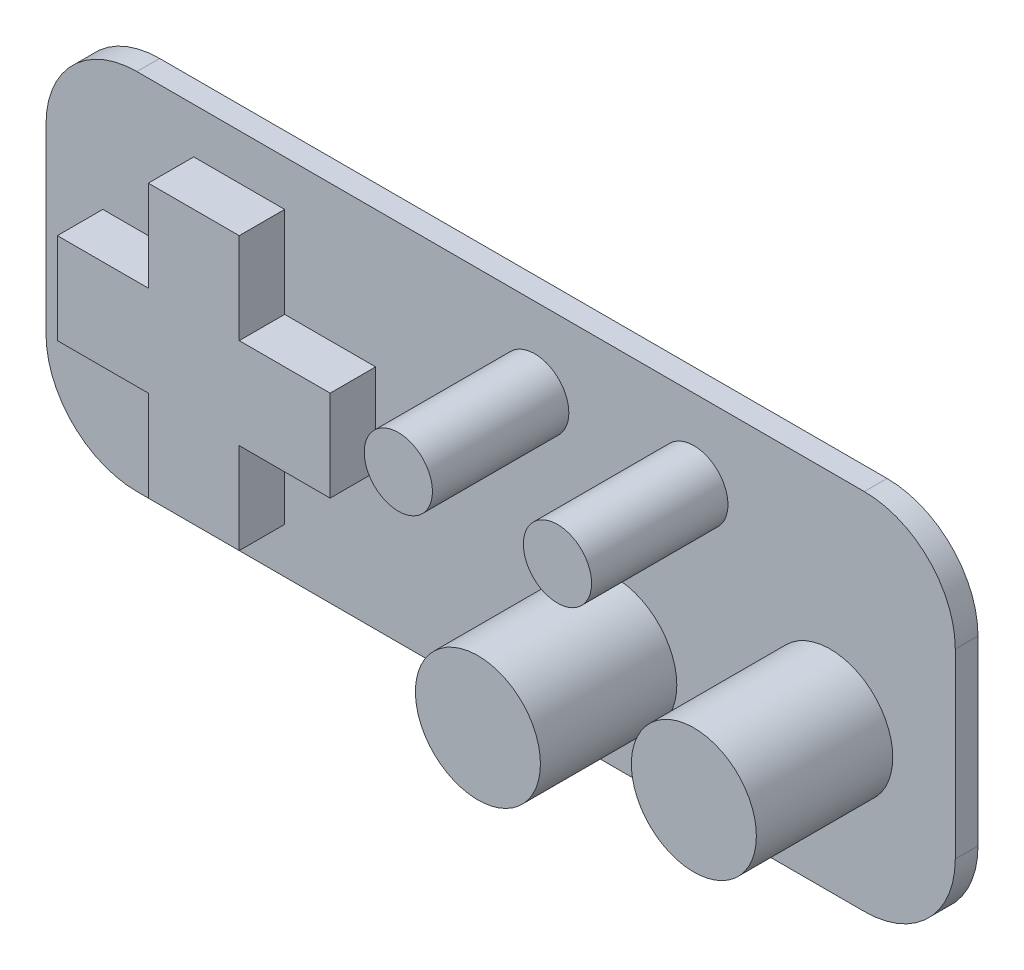
from build123d import *

# Parameters (mm, degrees)
EXTRUDE_1_DEPTH = 1
SKETCH_3_R      = 2.75
SKETCH_3_R_2    = 1.5
EXTRUDE_2_DEPTH = 6
EXTRUDE_3_DEPTH = 3


with BuildPart() as part:
    # 草图1 → 凸台-拉伸1 (new body)
    with BuildSketch(Plane.XY):
        with BuildLine():
            Line((-15.782608696, 8.75), (16.217391304, 8.75))
            ThreePointArc((16.217391304, 8.75), (19.045818429, 7.578427125), (20.217391304, 4.75))
            Line((20.217391304, 4.75), (20.217391304, -3.25))
            ThreePointArc((20.217391304, -3.25), (19.045818429, -6.078427125), (16.217391304, -7.25))
            Line((16.217391304, -7.25), (-15.782608696, -7.25))
            ThreePointArc((-15.782608696, -7.25), (-18.61103582, -6.078427125), (-19.782608696, -3.25))
            Line((-19.782608696, -3.25), (-19.782608696, 4.75))
            ThreePointArc((-19.782608696, 4.75), (-18.61103582, 7.578427125), (-15.782608696, 8.75))
        make_face()
    extrude(amount=EXTRUDE_1_DEPTH)

    # 草图3 → 凸台-拉伸2 (add)
    with BuildSketch(Plane.XY.offset(1)):
        with Locations((5.217391304, -2.75)):
            Circle(SKETCH_3_R)
        with Locations((14.717391304, -0.75)):
            Circle(SKETCH_3_R)
        with Locations((1.717391304, 5.25)):
            Circle(SKETCH_3_R_2)
        with Locations((8.717391304, 5.25)):
            Circle(SKETCH_3_R_2)
    extrude(amount=EXTRUDE_2_DEPTH)

    # 草图4 → 凸台-拉伸3 (add)
    with BuildSketch(Plane.XY):
        Polygon((-9.282608696, 6.75), (-13.282608696, 6.75), (-13.282608696, 2.75), (-17.282608696, 2.75), (-17.282608696, -1.25), (-13.282608696, -1.25), (-13.282608696, -5.25), (-9.282608696, -5.25), (-9.282608696, -1.25), (-5.282608696, -1.25), (-5.282608696, 2.75), (-9.282608696, 2.75), align=None)
    extrude(amount=EXTRUDE_3_DEPTH)


solid = part.part
